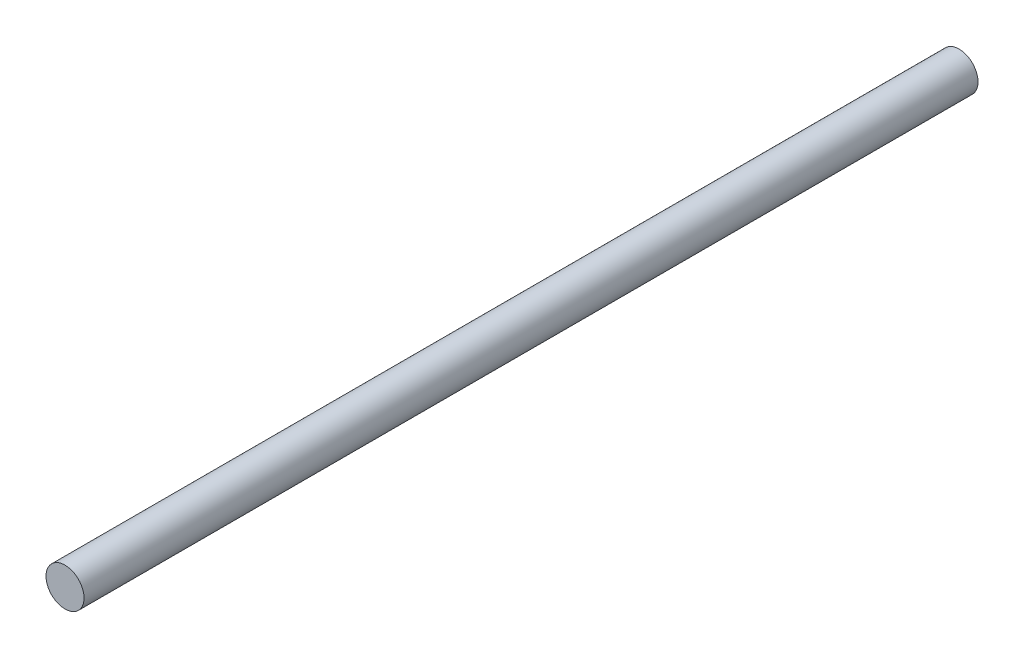
from build123d import *

# Parameters (mm, degrees)
SKETCH1_R           = 5
BOSS_EXTRUDE1_DEPTH = 235


with BuildPart() as part:
    # Sketch1 → Boss-Extrude1 (new body)
    with BuildSketch(Plane.XY):
        Circle(SKETCH1_R)
    extrude(amount=BOSS_EXTRUDE1_DEPTH)


solid = part.part
